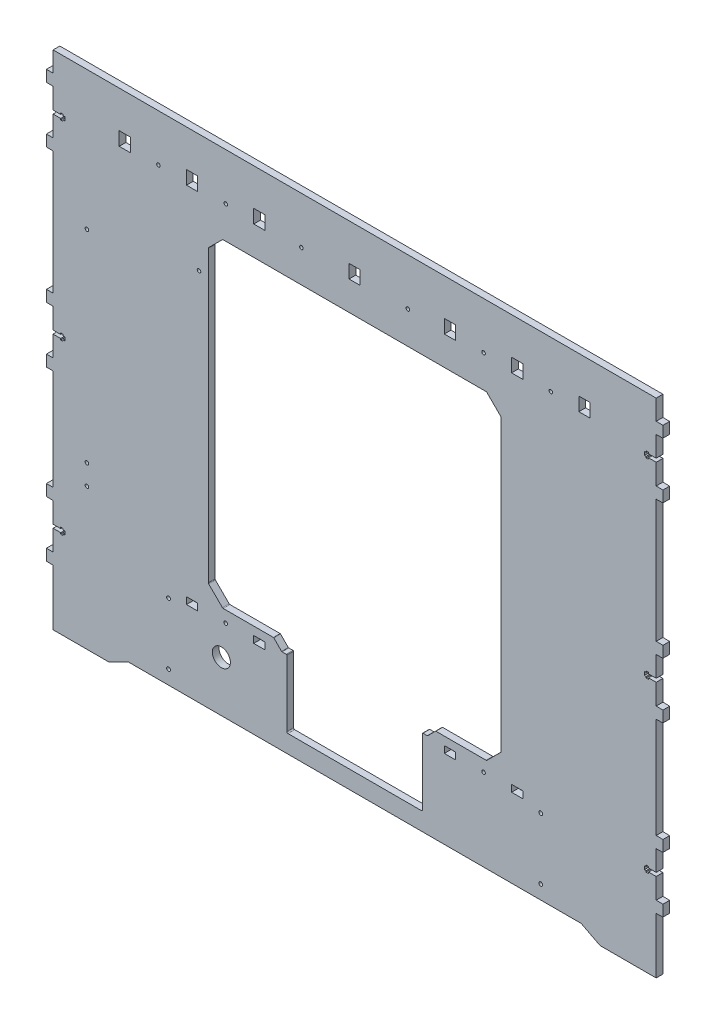
from build123d import *

# Parameters (mm, degrees)
SKETCH_2_R      = 1.6
SKETCH_2_R_2    = 1.7
SKETCH_2_R_3    = 8.05
SKETCH_2_W      = 10
SKETCH_2_H      = 12.1
SKETCH_2_H_2    = 6.1
EXTRUDE_2_DEPTH = 6


with BuildPart() as part:
    # Эскиз2 → Бобышка-Вытянуть2 (new body)
    with BuildSketch(Plane.XY):
        Polygon((39.191925364, 477.007239), (39.191925364, 472.107239), (33.191925364, 472.007239), (33.191925364, 462.007239), (39.191925364, 461.907239), (39.191925364, 443.557239), (45.991925364, 443.557239), (45.991925364, 444.757239), (48.191925364, 444.757239), (48.191925364, 443.557239), (49.691925364, 443.557239), (49.691925364, 440.457239), (48.191925364, 440.457239), (48.191925364, 439.257239), (45.991925364, 439.257239), (45.991925364, 440.457239), (39.191925364, 440.457239), (39.191925364, 422.107239), (33.191925364, 422.007239), (33.191925364, 412.007239), (39.191925364, 411.907239), (39.191925364, 302.107239), (33.191925364, 302.007239), (33.191925364, 292.007239), (39.191925364, 291.907239), (39.191925364, 273.557239), (45.991925364, 273.557239), (45.991925364, 274.757239), (48.191925364, 274.757239), (48.191925364, 273.557239), (49.691925364, 273.557239), (49.691925364, 270.457239), (48.191925364, 270.457239), (48.191925364, 269.257239), (45.991925364, 269.257239), (45.991925364, 270.457239), (39.191925364, 270.457239), (39.191925364, 252.107239), (33.191925364, 252.007239), (33.191925364, 242.007239), (39.191925364, 241.907239), (39.191925364, 152.107239), (33.191925364, 152.007239), (33.191925364, 142.007239), (39.191925364, 141.907239), (39.191925364, 123.557239), (45.991925364, 123.557239), (45.991925364, 124.757239), (48.191925364, 124.757239), (48.191925364, 123.557239), (49.691925364, 123.557239), (49.691925364, 120.457239), (48.191925364, 120.457239), (48.191925364, 119.257239), (45.991925364, 119.257239), (45.991925364, 120.457239), (39.191925364, 120.457239), (39.191925364, 102.107239), (33.191925364, 102.007239), (33.191925364, 92.007239), (39.191925364, 91.907239), (39.191925364, 42.007239), (89.191925364, 42.007239), (106.191925364, 50.707239), (510.191925364, 50.707239), (527.191925364, 42.007239), (577.191925364, 42.007239), (577.191925364, 91.907239), (583.191925364, 92.007239), (583.191925364, 102.007239), (577.191925364, 102.107239), (577.191925364, 120.457239), (570.391925364, 120.457239), (570.391925364, 119.257239), (568.191925364, 119.257239), (568.191925364, 120.457239), (566.691925364, 120.457239), (566.691925364, 123.557239), (568.191925364, 123.557239), (568.191925364, 124.757239), (570.391925364, 124.757239), (570.391925364, 123.557239), (577.191925364, 123.557239), (577.191925364, 141.907239), (583.191925364, 142.007239), (583.191925364, 152.007239), (577.191925364, 152.107239), (577.191925364, 241.907239), (583.191925364, 242.007239), (583.191925364, 252.007239), (577.191925364, 252.107239), (577.191925364, 270.457239), (570.391925364, 270.457239), (570.391925364, 269.257239), (568.191925364, 269.257239), (568.191925364, 270.457239), (566.691925364, 270.457239), (566.691925364, 273.557239), (568.191925364, 273.557239), (568.191925364, 274.757239), (570.391925364, 274.757239), (570.391925364, 273.557239), (577.191925364, 273.557239), (577.191925364, 291.907239), (583.191925364, 292.007239), (583.191925364, 302.007239), (577.191925364, 302.107239), (577.191925364, 411.907239), (583.191925364, 412.007239), (583.191925364, 422.007239), (577.191925364, 422.107239), (577.191925364, 440.457239), (570.391925364, 440.457239), (570.391925364, 439.257239), (568.191925364, 439.257239), (568.191925364, 440.457239), (566.691925364, 440.457239), (566.691925364, 443.557239), (568.191925364, 443.557239), (568.191925364, 444.757239), (570.391925364, 444.757239), (570.391925364, 443.557239), (577.191925364, 443.557239), (577.191925364, 461.907239), (583.191925364, 462.007239), (583.191925364, 472.007239), (577.191925364, 472.107239), (577.191925364, 477.007239), (577.191925364, 490.007239), (267.191925364, 490.007239), (39.191925364, 490.007239), align=None)
        with Locations((260.691925364, 448.057239)):
            Circle(SKETCH_2_R, mode=Mode.SUBTRACT)
        with Locations((193.191925364, 448.057239)):
            Circle(SKETCH_2_R, mode=Mode.SUBTRACT)
        with Locations((169.364369364, 384.459314)):
            Circle(SKETCH_2_R, mode=Mode.SUBTRACT)
        with Locations((69.364369364, 366.459314)):
            Circle(SKETCH_2_R, mode=Mode.SUBTRACT)
        with Locations((69.364369364, 186.089314)):
            Circle(SKETCH_2_R, mode=Mode.SUBTRACT)
        with Locations((69.364369364, 168.089314)):
            Circle(SKETCH_2_R, mode=Mode.SUBTRACT)
        with Locations((193.191925364, 124.054914)):
            Circle(SKETCH_2_R, mode=Mode.SUBTRACT)
        with Locations((142.191925364, 117.904914)):
            Circle(SKETCH_2_R_2, mode=Mode.SUBTRACT)
        with Locations((142.191925364, 63.104914)):
            Circle(SKETCH_2_R_2, mode=Mode.SUBTRACT)
        with Locations((189.304525403, 95.826887814)):
            Circle(SKETCH_2_R_3, mode=Mode.SUBTRACT)
        with Locations((474.191925364, 63.104914)):
            Circle(SKETCH_2_R_2, mode=Mode.SUBTRACT)
        with Locations((474.191925364, 117.904914)):
            Circle(SKETCH_2_R_2, mode=Mode.SUBTRACT)
        with Locations((423.191925364, 124.054914)):
            Circle(SKETCH_2_R, mode=Mode.SUBTRACT)
        with Locations((423.191925364, 448.057239)):
            Circle(SKETCH_2_R, mode=Mode.SUBTRACT)
        with Locations((355.691925364, 448.057239)):
            Circle(SKETCH_2_R, mode=Mode.SUBTRACT)
        with Locations((483.191925364, 448.057239)):
            Circle(SKETCH_2_R, mode=Mode.SUBTRACT)
        with Locations((133.191925364, 448.057239)):
            Circle(SKETCH_2_R, mode=Mode.SUBTRACT)
        with Locations((308.191925364, 451.057239)):
            Rectangle(SKETCH_2_W, SKETCH_2_H, mode=Mode.SUBTRACT)
        with Locations((223.191925364, 124.054914)):
            Rectangle(SKETCH_2_W, SKETCH_2_H_2, mode=Mode.SUBTRACT)
        with Locations((163.191925364, 124.054914)):
            Rectangle(SKETCH_2_W, SKETCH_2_H_2, mode=Mode.SUBTRACT)
        with Locations((163.191925364, 451.057239)):
            Rectangle(SKETCH_2_W, SKETCH_2_H, mode=Mode.SUBTRACT)
        with Locations((223.191925364, 451.057239)):
            Rectangle(SKETCH_2_W, SKETCH_2_H, mode=Mode.SUBTRACT)
        with BuildLine():
            Line((367.691925364, 66.604914), (248.691925364, 66.604914))
            ThreePointArc((248.691925364, 66.604914), (247.984818583, 66.897807219), (247.691925364, 67.604914))
            Line((247.691925364, 67.604914), (247.691925364, 126.604914))
            ThreePointArc((247.691925364, 126.604914), (247.545478755, 126.958467391), (247.191925364, 127.104914))
            Line((247.191925364, 127.104914), (243.399032145, 127.104914))
            ThreePointArc((243.399032145, 127.104914), (243.207690429, 127.142974234), (243.045478755, 127.251360609))
            Line((243.045478755, 127.251360609), (239.551511864, 130.7453275))
            Line((239.551511864, 130.7453275), (236.057544974, 134.239294391))
            ThreePointArc((236.057544974, 134.239294391), (235.895333299, 134.347680766), (235.703991583, 134.385741))
            Line((235.703991583, 134.385741), (213.330786974, 134.385741))
            Line((213.330786974, 134.385741), (190.957582097, 134.385741))
            ThreePointArc((190.957582097, 134.385741), (190.576531552, 134.461186793), (190.252978328, 134.676140036))
            Line((190.252978328, 134.676140036), (184.106371864, 140.7794605))
            Line((184.106371864, 140.7794605), (177.959765595, 146.882780771))
            ThreePointArc((177.959765595, 146.882780771), (177.74116739, 147.20806661), (177.664369364, 147.592381735))
            Line((177.664369364, 147.592381735), (177.664369364, 169.701128817))
            Line((177.664369364, 169.701128817), (177.664369364, 405.962673265))
            ThreePointArc((177.664369364, 405.962673265), (177.741167398, 406.346988409), (177.959765623, 406.672274257))
            Line((177.959765623, 406.672274257), (184.106372364, 412.7755945))
            Line((184.106372364, 412.7755945), (190.252979357, 418.878914993))
            ThreePointArc((190.252979357, 418.878914993), (190.576532571, 419.093868215), (190.957583097, 419.169314))
            Line((190.957583097, 419.169314), (308.137936364, 419.169314))
            Line((308.137936364, 419.169314), (308.245914364, 419.169314))
            Line((308.245914364, 419.169314), (425.426267631, 419.169314))
            ThreePointArc((425.426267631, 419.169314), (425.807318157, 419.093868215), (426.130871372, 418.878914993))
            Line((426.130871372, 418.878914993), (432.277478364, 412.7755945))
            Line((432.277478364, 412.7755945), (438.424085105, 406.672274257))
            ThreePointArc((438.424085105, 406.672274257), (438.64268333, 406.346988409), (438.719481364, 405.962673265))
            Line((438.719481364, 405.962673265), (438.719481364, 169.701128817))
            Line((438.719481364, 169.701128817), (438.719481364, 147.592381735))
            ThreePointArc((438.719481364, 147.592381735), (438.642683338, 147.20806661), (438.424085134, 146.882780771))
            Line((438.424085134, 146.882780771), (432.277478864, 140.7794605))
            Line((432.277478864, 140.7794605), (426.1308724, 134.676140036))
            ThreePointArc((426.1308724, 134.676140036), (425.807319176, 134.461186793), (425.426268631, 134.385741))
            Line((425.426268631, 134.385741), (403.053063755, 134.385741))
            Line((403.053063755, 134.385741), (380.679859145, 134.385741))
            ThreePointArc((380.679859145, 134.385741), (380.488517429, 134.347680766), (380.326305755, 134.239294391))
            Line((380.326305755, 134.239294391), (376.832338864, 130.7453275))
            Line((376.832338864, 130.7453275), (373.338371974, 127.251360609))
            ThreePointArc((373.338371974, 127.251360609), (373.176160299, 127.142974234), (372.984818583, 127.104914))
            Line((372.984818583, 127.104914), (369.191925364, 127.104914))
            ThreePointArc((369.191925364, 127.104914), (368.838371974, 126.958467391), (368.691925364, 126.604914))
            Line((368.691925364, 126.604914), (368.691925364, 67.604914))
            ThreePointArc((368.691925364, 67.604914), (368.399032145, 66.897807219), (367.691925364, 66.604914))
        make_face(mode=Mode.SUBTRACT)
        with Locations((103.191925364, 451.057239)):
            Rectangle(SKETCH_2_W, SKETCH_2_H, mode=Mode.SUBTRACT)
        with Locations((513.191925364, 451.057239)):
            Rectangle(SKETCH_2_W, SKETCH_2_H, mode=Mode.SUBTRACT)
        with Locations((393.191925364, 451.057239)):
            Rectangle(SKETCH_2_W, SKETCH_2_H, mode=Mode.SUBTRACT)
        with Locations((453.191925364, 451.057239)):
            Rectangle(SKETCH_2_W, SKETCH_2_H, mode=Mode.SUBTRACT)
        with Locations((453.191925364, 124.054914)):
            Rectangle(SKETCH_2_W, SKETCH_2_H_2, mode=Mode.SUBTRACT)
        with Locations((393.191925364, 124.054914)):
            Rectangle(SKETCH_2_W, SKETCH_2_H_2, mode=Mode.SUBTRACT)
    extrude(amount=EXTRUDE_2_DEPTH)


solid = part.part
